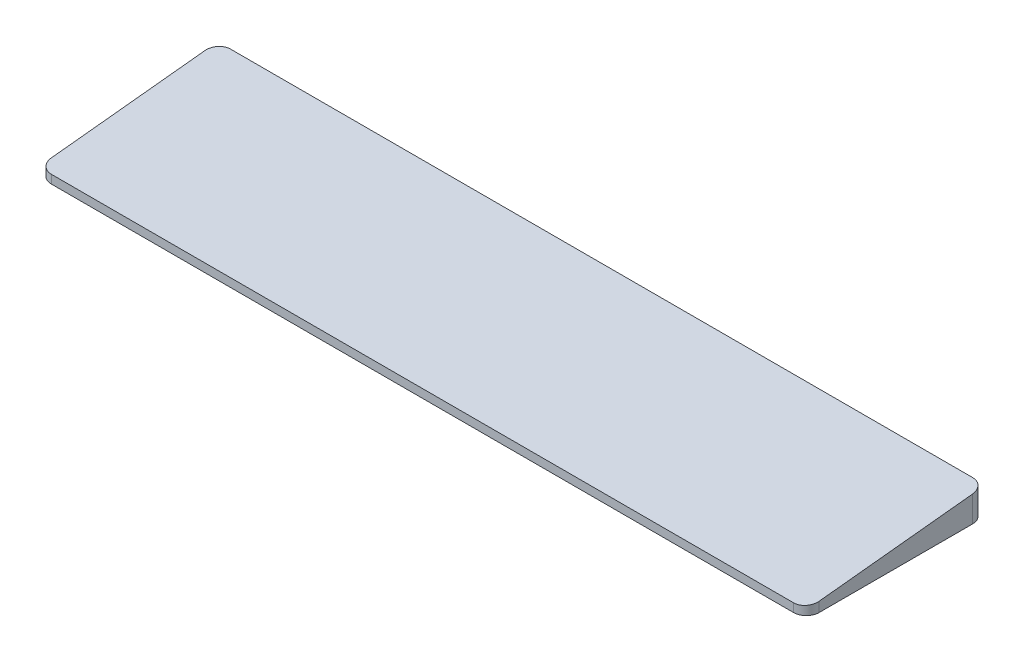
from build123d import *

# Parameters (mm, degrees)
BOSS_EXTRUDE1_REACH = 317.752
SKETCH1_W           = 300
SKETCH1_H           = 70
FILLET1_R           = 5
SKETCH2_R           = 1
CUT_EXTRUDE3_DEPTH  = 2


with BuildPart() as part:
    # Boss-Extrude1: up to this plane
    boss_extrude1_end = Plane(origin=(0, 3.281922255, 0.344943929), z_dir=(0, 0.9945218953682733, 0.10452846326765369))
    # Sketch1 → Boss-Extrude1 (new, up to the surface)
    with BuildSketch(Plane(origin=(0, 0, 0), x_dir=(1, 0, 0), z_dir=(0, 1, 0)), mode=Mode.PRIVATE) as boss_extrude1_sk1:
        with Locations((150, 35)):
            Rectangle(SKETCH1_W, SKETCH1_H)
    boss_extrude1_tool1 = split(extrude(boss_extrude1_sk1.sketch, amount=BOSS_EXTRUDE1_REACH, mode=Mode.PRIVATE), bisect_by=boss_extrude1_end, keep=Keep.BOTH, mode=Mode.PRIVATE)
    add(boss_extrude1_tool1.solids().sort_by_distance((150, 0, -35))[0])

    # Fillet1
    fillet1_edges = [part.edges().sort_by_distance(p)[0] for p in [
        (300, 5.337736896, -70),
        (300, 1.659088661, 0),
        (0, 1.659088661, 0),
        (0, 5.337736896, -70),
    ]]
    fillet(fillet1_edges, radius=FILLET1_R)

    # Sketch2 → Cut-Extrude3 (cut)
    with BuildSketch(Plane.XZ):
        with BuildLine():
            ThreePointArc((151, -39), (152, -40), (153, -39))
            Line((153, -39), (153, -25))
            ThreePointArc((153, -25), (152, -24), (151, -25))
            Line((151, -25), (151, -34))
            Line((151, -34), (149, -34))
            ThreePointArc((149, -34), (148, -35), (149, -36))
            Line((149, -36), (151, -36))
            Line((151, -36), (151, -39))
        make_face()
        with BuildLine():
            ThreePointArc((155.5, -31.5), (156.5, -32.5), (157.5, -31.5))
            Line((157.5, -31.5), (157.5, -21))
            ThreePointArc((157.5, -21), (156.5, -20), (155.5, -21))
            Line((155.5, -21), (155.5, -31.5))
        make_face()
        with BuildLine():
            ThreePointArc((146.2, -31.5), (147.2, -32.5), (148.2, -31.5))
            Line((148.2, -31.5), (148.2, -25.5))
            ThreePointArc((148.2, -25.5), (147.2, -24.5), (146.2, -25.5))
            Line((146.2, -25.5), (146.2, -31.5))
        make_face()
        with BuildLine():
            ThreePointArc((142.7, -31.5), (143.7, -32.5), (144.7, -31.5))
            Line((144.7, -31.5), (144.7, -25.5))
            ThreePointArc((144.7, -25.5), (143.7, -24.5), (142.7, -25.5))
            Line((142.7, -25.5), (142.7, -31.5))
        make_face()
        with BuildLine():
            ThreePointArc((139.2, -31.5), (140.2, -32.5), (141.2, -31.5))
            Line((141.2, -31.5), (141.2, -25.5))
            ThreePointArc((141.2, -25.5), (140.2, -24.5), (139.2, -25.5))
            Line((139.2, -25.5), (139.2, -31.5))
        make_face()
        with BuildLine():
            ThreePointArc((159, -23.5), (160, -24.5), (161, -23.5))
            Line((161, -23.5), (161, -21))
            ThreePointArc((161, -21), (160, -20), (159, -21))
            Line((159, -21), (159, -23.5))
        make_face()
        with Locations((156.5, -35)):
            Circle(SKETCH2_R)
    extrude(amount=-CUT_EXTRUDE3_DEPTH, mode=Mode.SUBTRACT)


solid = part.part
